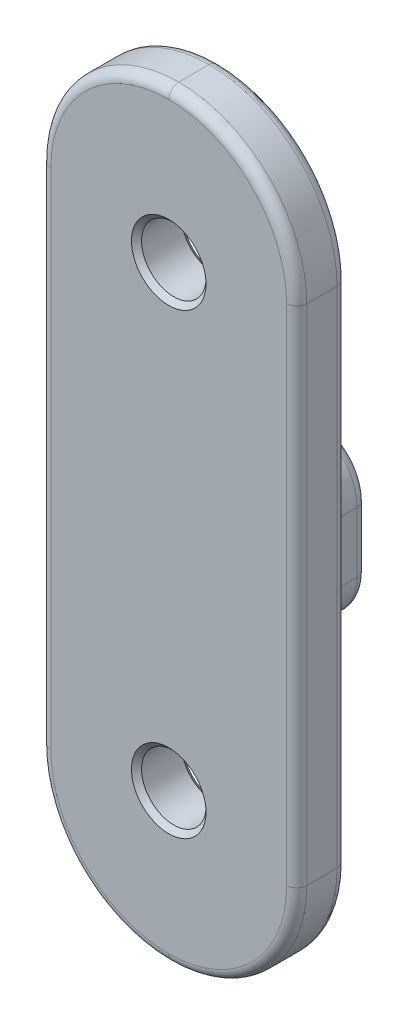
from build123d import *

# Parameters (mm, degrees)
SKETCH1_W        = 25.4
SKETCH1_H        = 75.4
SKETCH1_R        = 3.2
MAINBODY_DEPTH   = 5
SKETCH2_W        = 21.4
SKETCH2_H        = 16
RIBSUPPORT_DEPTH = 4
FILLET_12_7_R    = 12.7
FILLET_5_0_R     = 5
CHAMFER_0_5_SIZE = 0.5
FILLET_1_0_R     = 1


with BuildPart() as part:
    # Sketch1 → mainBody (new body)
    with BuildSketch(Plane.XY):
        with Locations((0, 22.7)):
            Rectangle(SKETCH1_W, SKETCH1_H)
        Circle(SKETCH1_R, mode=Mode.SUBTRACT)
        with Locations((0, 45.4)):
            Circle(SKETCH1_R, mode=Mode.SUBTRACT)
    extrude(amount=MAINBODY_DEPTH)

    # Sketch2 → ribSupport (add)
    with BuildSketch(Plane(origin=(0, 0, 0), x_dir=(-1, 0, 0), z_dir=(0, 0, -1))):
        with Locations((0, 22.7)):
            Rectangle(SKETCH2_W, SKETCH2_H)
    extrude(amount=RIBSUPPORT_DEPTH)

    # Fillet-12.7
    fillet_12_7_edges = [part.edges().sort_by_distance(p)[0] for p in [
        (-12.7, -15, 2.5),
        (12.7, -15, 2.5),
        (-12.7, 60.4, 2.5),
        (12.7, 60.4, 2.5),
    ]]
    fillet(fillet_12_7_edges, radius=FILLET_12_7_R - 0.0001)  # a hair under: the kernel refuses the full size

    # Fillet-5.0
    fillet_5_0_edges = [part.edges().sort_by_distance(p)[0] for p in [
        (10.7, 30.7, -2),
        (10.7, 14.7, -2),
        (-10.7, 14.7, -2),
        (-10.7, 30.7, -2),
    ]]
    fillet(fillet_5_0_edges, radius=FILLET_5_0_R)

    # Chamfer-0.5
    chamfer_0_5_edges = [part.edges().sort_by_distance(p)[0] for p in [
        (-3.2, 0, 0),
        (-3.2, 0, 5),
        (-3.2, 45.4, 0),
        (-3.2, 45.4, 5),
    ]]
    chamfer(chamfer_0_5_edges, length=CHAMFER_0_5_SIZE)

    # Fillet-1.0
    fillet_1_0_edges = [part.edges().sort_by_distance(p)[0] for p in [
        (-12.7, 22.7, 0),
        (12.7, 22.7, 0),
        (8.98028541, 56.68028541, 0),
        (-8.98028541, 56.68028541, 0),
        (8.98028541, -11.28028541, 0),
        (-8.98028541, -11.28028541, 0),
        (-12.7, 22.7, 5),
        (12.7, 22.7, 5),
        (8.98028541, 56.68028541, 5),
        (-8.98028541, 56.68028541, 5),
        (8.98028541, -11.28028541, 5),
        (-8.98028541, -11.28028541, 5),
        (0, 30.7, 0),
        (0, 30.7, -4),
        (-10.7, 22.7, 0),
        (-10.7, 22.7, -4),
        (10.7, 22.7, -4),
        (0, 14.7, -4),
        (9.235533906, 29.235533906, -4),
        (9.235533906, 16.164466094, -4),
        (-9.235533906, 16.164466094, -4),
        (-9.235533906, 29.235533906, -4),
        (0, 14.7, 0),
        (10.7, 22.7, 0),
        (-9.235533906, 29.235533906, 0),
        (-9.235533906, 16.164466094, 0),
        (9.235533906, 16.164466094, 0),
        (9.235533906, 29.235533906, 0),
    ]]
    fillet(fillet_1_0_edges, radius=FILLET_1_0_R - 0.0001)  # a hair under: the kernel refuses the full size


solid = part.part
